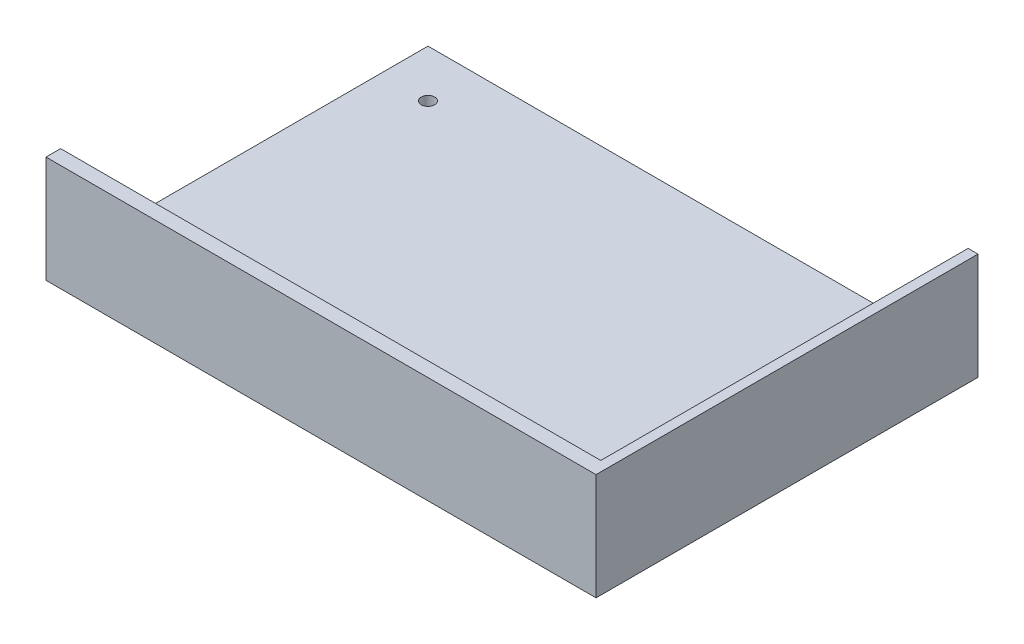
from build123d import *

# Parameters (mm, degrees)
SKETCH1_W                     = 278.2
SKETCH1_H                     = 193.2
SHELL_BLOCK_DEPTH             = 27
SKETCH2_W                     = 273.2
SKETCH2_H                     = 185.8
FRONT_OPENING_DEPTH           = 1.5
SKETCH3_W                     = 273.2
SKETCH3_H                     = 188.2
DISPLAY_POCKET_DEPTH          = 22.5
SKETCH4_W                     = 3
SKETCH4_H                     = 56
VENT_SLOTS_DEPTH              = 4
SKETCH5_W                     = 58
SKETCH5_H                     = 16
CABLE_EXIT_X_SHORT_SIDE_DEPTH = 140.1
SKETCH6_R                     = 1.7
BOLT_HOLES_DEPTH              = 4
KEEP_ONE_HALF_X_DEPTH         = 172.491603293
KEEP_ONE_HALF_X_DEPTH_BACK    = 172.491603293
SKETCH7_W                     = 200
SKETCH7_H                     = 400
KEEP_ONE_QUARTER_Z_DEPTH      = 172.491603293
KEEP_ONE_QUARTER_Z_DEPTH_BACK = 172.491603293
SKETCH8_W                     = 400
SKETCH8_H                     = 200


with BuildPart() as part:
    # Sketch1 → Shell Block (new body)
    with BuildSketch(Plane(origin=(0, 0, 0), x_dir=(1, 0, 0), z_dir=(0, 1, 0))):
        Rectangle(SKETCH1_W, SKETCH1_H)
    extrude(amount=SHELL_BLOCK_DEPTH)

    # Sketch2 → Front Opening (cut)
    with BuildSketch(Plane(origin=(0, 27, 0), x_dir=(1, 0, 0), z_dir=(0, 1, 0))):
        Rectangle(SKETCH2_W, SKETCH2_H)
    extrude(amount=-FRONT_OPENING_DEPTH, mode=Mode.SUBTRACT)

    # Sketch3 → Display Pocket (cut)
    with BuildSketch(Plane(origin=(0, 25.5, 0), x_dir=(1, 0, 0), z_dir=(0, 1, 0))):
        Rectangle(SKETCH3_W, SKETCH3_H)
    extrude(amount=-DISPLAY_POCKET_DEPTH, mode=Mode.SUBTRACT)

    # Sketch4 → Vent Slots (cut)
    with BuildSketch(Plane(origin=(0, 3, 0), x_dir=(1, 0, 0), z_dir=(0, 1, 0))):
        with Locations((-67.5, 56)):
            Rectangle(SKETCH4_W, SKETCH4_H)
        with Locations((-67.5, -56)):
            Rectangle(SKETCH4_W, SKETCH4_H)
        with Locations((-75.5, 56)):
            Rectangle(SKETCH4_W, SKETCH4_H)
        with Locations((-75.5, -56)):
            Rectangle(SKETCH4_W, SKETCH4_H)
        with Locations((-83.5, 56)):
            Rectangle(SKETCH4_W, SKETCH4_H)
        with Locations((-83.5, -56)):
            Rectangle(SKETCH4_W, SKETCH4_H)
        with Locations((-91.5, 56)):
            Rectangle(SKETCH4_W, SKETCH4_H)
        with Locations((-91.5, -56)):
            Rectangle(SKETCH4_W, SKETCH4_H)
        with Locations((-99.5, 56)):
            Rectangle(SKETCH4_W, SKETCH4_H)
        with Locations((-99.5, -56)):
            Rectangle(SKETCH4_W, SKETCH4_H)
        with Locations((-107.5, 56)):
            Rectangle(SKETCH4_W, SKETCH4_H)
        with Locations((-107.5, -56)):
            Rectangle(SKETCH4_W, SKETCH4_H)
        with Locations((-115.5, 56)):
            Rectangle(SKETCH4_W, SKETCH4_H)
        with Locations((-115.5, -56)):
            Rectangle(SKETCH4_W, SKETCH4_H)
        with Locations((-123.5, 56)):
            Rectangle(SKETCH4_W, SKETCH4_H)
        with Locations((-123.5, -56)):
            Rectangle(SKETCH4_W, SKETCH4_H)
    extrude(amount=-VENT_SLOTS_DEPTH, mode=Mode.SUBTRACT)

    # Sketch5 → Cable Exit (-X short side) (cut)
    with BuildSketch(Plane(origin=(0, 0, 0), x_dir=(0, 0, -1), z_dir=(1, 0, 0))):
        with Locations((0, 13)):
            Rectangle(SKETCH5_W, SKETCH5_H)
    extrude(amount=-CABLE_EXIT_X_SHORT_SIDE_DEPTH, mode=Mode.SUBTRACT)

    # Sketch6 → Bolt Holes (cut)
    with BuildSketch(Plane(origin=(0, 3, 0), x_dir=(1, 0, 0), z_dir=(0, 1, 0))):
        with Locations((-40, 18)):
            Circle(SKETCH6_R)
        with Locations((-40, 88)):
            Circle(SKETCH6_R)
        with Locations((40, 18)):
            Circle(SKETCH6_R)
        with Locations((40, 88)):
            Circle(SKETCH6_R)
        with Locations((-52, 40)):
            Circle(SKETCH6_R)
        with Locations((-52, 66)):
            Circle(SKETCH6_R)
        with Locations((52, 40)):
            Circle(SKETCH6_R)
        with Locations((52, 66)):
            Circle(SKETCH6_R)
        with Locations((-12, -82)):
            Circle(SKETCH6_R)
        with Locations((12, -82)):
            Circle(SKETCH6_R)
        with Locations((124, -12)):
            Circle(SKETCH6_R)
        with Locations((124, 12)):
            Circle(SKETCH6_R)
        with Locations((-12, -12)):
            Circle(SKETCH6_R)
        with Locations((-12, 12)):
            Circle(SKETCH6_R)
        with Locations((12, -12)):
            Circle(SKETCH6_R)
        with Locations((12, 12)):
            Circle(SKETCH6_R)
        with Locations((-110, 12)):
            Circle(SKETCH6_R)
        with Locations((-110, -12)):
            Circle(SKETCH6_R)
        with Locations((-86, 12)):
            Circle(SKETCH6_R)
        with Locations((-86, -12)):
            Circle(SKETCH6_R)
    extrude(amount=-BOLT_HOLES_DEPTH, mode=Mode.SUBTRACT)

    # Sketch7 → Keep one half (X) (cut, two sides: drawn at the far end of the back side and taken through both)
    with BuildSketch(Plane(origin=(0, 0, 0), x_dir=(1, 0, 0), z_dir=(0, 1, 0)).offset(-KEEP_ONE_HALF_X_DEPTH_BACK)):
        with Locations((-100, 0)):
            Rectangle(SKETCH7_W, SKETCH7_H)
    extrude(amount=KEEP_ONE_HALF_X_DEPTH + KEEP_ONE_HALF_X_DEPTH_BACK, mode=Mode.SUBTRACT)

    # Sketch8 → Keep one quarter (Z) (cut, two sides: drawn at the far end of the back side and taken through both)
    with BuildSketch(Plane(origin=(0, 0, 0), x_dir=(1, 0, 0), z_dir=(0, 1, 0)).offset(-KEEP_ONE_QUARTER_Z_DEPTH_BACK)):
        with Locations((0, 100)):
            Rectangle(SKETCH8_W, SKETCH8_H)
    extrude(amount=KEEP_ONE_QUARTER_Z_DEPTH + KEEP_ONE_QUARTER_Z_DEPTH_BACK, mode=Mode.SUBTRACT)


solid = part.part
